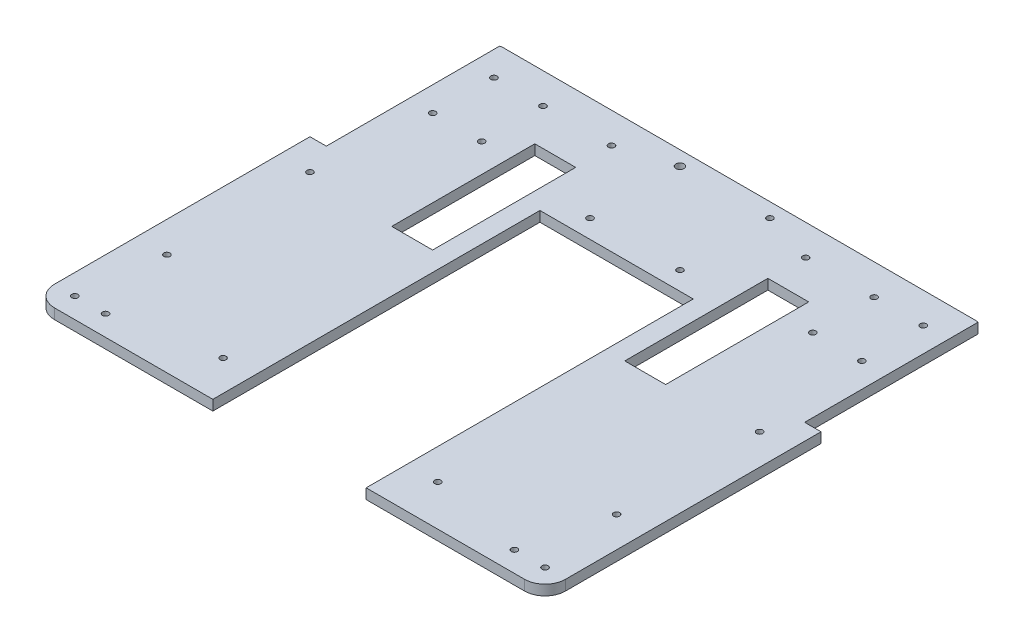
from build123d import *

# Parameters (mm, degrees)
EXTRUDE_1_DEPTH      = 5
SKETCH_5_W           = 75
SKETCH_5_H           = 160
CUT_EXTRUDE_4_DEPTH  = 5
CUT_EXTRUDE_5_REACH  = 335.054
SKETCH_6_R           = 1.5
CUT_EXTRUDE_8_REACH  = 335.054
SKETCH_8_R           = 1.5
CUT_EXTRUDE_9_REACH  = 335.054
SKETCH_9_R           = 1.5
CUT_EXTRUDE_10_REACH = 335.054
SKETCH_10_W          = 8
SKETCH_10_H          = 85
SKETCH_11_R          = 1.5
CUT_EXTRUDE_11_DEPTH = 10
SKETCH_12_R          = 1.5
CUT_EXTRUDE_12_DEPTH = 10
SKETCH_13_W          = 20
SKETCH_13_H          = 70
CUT_EXTRUDE_13_DEPTH = 10
SKETCH_14_R          = 2
SKETCH_14_R_2        = 1.5
CUT_EXTRUDE_14_DEPTH = 10


with BuildPart() as part:
    # 草图1 → 凸台-拉伸1 (new body)
    with BuildSketch(Plane(origin=(0, 0, 0), x_dir=(1, 0, 0), z_dir=(0, 1, 0))):
        with BuildLine():
            Line((10, 0), (240, 0))
            ThreePointArc((240, 0), (247.071067812, -2.928932188), (250, -10))
            Line((250, -10), (250, -210))
            ThreePointArc((250, -210), (247.071067812, -217.071067812), (240, -220))
            Line((240, -220), (10, -220))
            ThreePointArc((10, -220), (2.928932188, -217.071067812), (0, -210))
            Line((0, -210), (0, -10))
            ThreePointArc((0, -10), (2.928932188, -2.928932188), (10, 0))
        make_face()
    extrude(amount=EXTRUDE_1_DEPTH)

    # 草图5 → 切除-拉伸4 (cut)
    with BuildSketch(Plane.XZ):
        with Locations((125, 140)):
            Rectangle(SKETCH_5_W, SKETCH_5_H)
    extrude(amount=-CUT_EXTRUDE_4_DEPTH, mode=Mode.SUBTRACT)

    # 草图6 → 切除-拉伸5 (cut, up to next)
    with BuildSketch(Plane.XZ, mode=Mode.PRIVATE) as cut_extrude_5_sk1:
        with Locations((72.5, 200)):
            Circle(SKETCH_6_R)
    cut_extrude_5_tool1 = extrude(cut_extrude_5_sk1.sketch, amount=-CUT_EXTRUDE_5_REACH, mode=Mode.PRIVATE) & part.part
    # 草图6 → 切除-拉伸5 (cut, up to next)
    with BuildSketch(Plane.XZ, mode=Mode.PRIVATE) as cut_extrude_5_sk2:
        with Locations((177.5, 200)):
            Circle(SKETCH_6_R)
    cut_extrude_5_tool2 = extrude(cut_extrude_5_sk2.sketch, amount=-CUT_EXTRUDE_5_REACH, mode=Mode.PRIVATE) & part.part
    add(cut_extrude_5_tool1.solids().sort_by_distance((72.5, 0, 200))[0], mode=Mode.SUBTRACT)
    add(cut_extrude_5_tool2.solids().sort_by_distance((177.5, 0, 200))[0], mode=Mode.SUBTRACT)

    # 草图8 → 切除-拉伸8 (cut, up to next)
    with BuildSketch(Plane.XZ, mode=Mode.PRIVATE) as cut_extrude_8_sk1:
        with Locations((235, 170)):
            Circle(SKETCH_8_R)
    cut_extrude_8_tool1 = extrude(cut_extrude_8_sk1.sketch, amount=-CUT_EXTRUDE_8_REACH, mode=Mode.PRIVATE) & part.part
    # 草图8 → 切除-拉伸8 (cut, up to next)
    with BuildSketch(Plane.XZ, mode=Mode.PRIVATE) as cut_extrude_8_sk2:
        with Locations((235, 100)):
            Circle(SKETCH_8_R)
    cut_extrude_8_tool2 = extrude(cut_extrude_8_sk2.sketch, amount=-CUT_EXTRUDE_8_REACH, mode=Mode.PRIVATE) & part.part
    # 草图8 → 切除-拉伸8 (cut, up to next)
    with BuildSketch(Plane.XZ, mode=Mode.PRIVATE) as cut_extrude_8_sk3:
        with Locations((15, 100)):
            Circle(SKETCH_8_R)
    cut_extrude_8_tool3 = extrude(cut_extrude_8_sk3.sketch, amount=-CUT_EXTRUDE_8_REACH, mode=Mode.PRIVATE) & part.part
    # 草图8 → 切除-拉伸8 (cut, up to next)
    with BuildSketch(Plane.XZ, mode=Mode.PRIVATE) as cut_extrude_8_sk4:
        with Locations((15, 170)):
            Circle(SKETCH_8_R)
    cut_extrude_8_tool4 = extrude(cut_extrude_8_sk4.sketch, amount=-CUT_EXTRUDE_8_REACH, mode=Mode.PRIVATE) & part.part
    add(cut_extrude_8_tool1.solids().sort_by_distance((235, 0, 170))[0], mode=Mode.SUBTRACT)
    add(cut_extrude_8_tool2.solids().sort_by_distance((235, 0, 100))[0], mode=Mode.SUBTRACT)
    add(cut_extrude_8_tool3.solids().sort_by_distance((15, 0, 100))[0], mode=Mode.SUBTRACT)
    add(cut_extrude_8_tool4.solids().sort_by_distance((15, 0, 170))[0], mode=Mode.SUBTRACT)

    # 草图9 → 切除-拉伸9 (cut, up to next)
    with BuildSketch(Plane.XZ, mode=Mode.PRIVATE) as cut_extrude_9_sk1:
        with Locations((77.5, 15)):
            Circle(SKETCH_9_R)
    cut_extrude_9_tool1 = extrude(cut_extrude_9_sk1.sketch, amount=-CUT_EXTRUDE_9_REACH, mode=Mode.PRIVATE) & part.part
    # 草图9 → 切除-拉伸9 (cut, up to next)
    with BuildSketch(Plane.XZ, mode=Mode.PRIVATE) as cut_extrude_9_sk2:
        with Locations((10, 210)):
            Circle(SKETCH_9_R)
    cut_extrude_9_tool2 = extrude(cut_extrude_9_sk2.sketch, amount=-CUT_EXTRUDE_9_REACH, mode=Mode.PRIVATE) & part.part
    # 草图9 → 切除-拉伸9 (cut, up to next)
    with BuildSketch(Plane.XZ, mode=Mode.PRIVATE) as cut_extrude_9_sk3:
        with Locations((240, 210)):
            Circle(SKETCH_9_R)
    cut_extrude_9_tool3 = extrude(cut_extrude_9_sk3.sketch, amount=-CUT_EXTRUDE_9_REACH, mode=Mode.PRIVATE) & part.part
    # 草图9 → 切除-拉伸9 (cut, up to next)
    with BuildSketch(Plane.XZ, mode=Mode.PRIVATE) as cut_extrude_9_sk4:
        with Locations((172.5, 15)):
            Circle(SKETCH_9_R)
    cut_extrude_9_tool4 = extrude(cut_extrude_9_sk4.sketch, amount=-CUT_EXTRUDE_9_REACH, mode=Mode.PRIVATE) & part.part
    add(cut_extrude_9_tool1.solids().sort_by_distance((77.5, 0, 15))[0], mode=Mode.SUBTRACT)
    add(cut_extrude_9_tool2.solids().sort_by_distance((10, 0, 210))[0], mode=Mode.SUBTRACT)
    add(cut_extrude_9_tool3.solids().sort_by_distance((240, 0, 210))[0], mode=Mode.SUBTRACT)
    add(cut_extrude_9_tool4.solids().sort_by_distance((172.5, 0, 15))[0], mode=Mode.SUBTRACT)

    # 草图10 → 切除-拉伸10 (cut, up to next)
    with BuildSketch(Plane.XZ, mode=Mode.PRIVATE) as cut_extrude_10_sk1:
        with Locations((4, 42.5)):
            Rectangle(SKETCH_10_W, SKETCH_10_H)
    cut_extrude_10_tool1 = extrude(cut_extrude_10_sk1.sketch, amount=-CUT_EXTRUDE_10_REACH, mode=Mode.PRIVATE) & part.part
    # 草图10 → 切除-拉伸10 (cut, up to next)
    with BuildSketch(Plane.XZ, mode=Mode.PRIVATE) as cut_extrude_10_sk2:
        with Locations((246, 42.5)):
            Rectangle(SKETCH_10_W, SKETCH_10_H)
    cut_extrude_10_tool2 = extrude(cut_extrude_10_sk2.sketch, amount=-CUT_EXTRUDE_10_REACH, mode=Mode.PRIVATE) & part.part
    add(cut_extrude_10_tool1.solids().sort_by_distance((4, 0, 42.5))[0], mode=Mode.SUBTRACT)
    add(cut_extrude_10_tool2.solids().sort_by_distance((246, 0, 42.5))[0], mode=Mode.SUBTRACT)

    # 草图11 → 切除-拉伸11 (cut)
    with BuildSketch(Plane.XZ):
        with Locations((25, 210)):
            Circle(SKETCH_11_R)
        with Locations((225, 210)):
            Circle(SKETCH_11_R)
    extrude(amount=-CUT_EXTRUDE_11_DEPTH, mode=Mode.SUBTRACT)

    # 草图12 → 切除-拉伸12 (cut)
    with BuildSketch(Plane.XZ):
        with Locations((230, 15)):
            Circle(SKETCH_12_R)
        with Locations((206, 15)):
            Circle(SKETCH_12_R)
        with Locations((230, 45)):
            Circle(SKETCH_12_R)
        with Locations((206, 45)):
            Circle(SKETCH_12_R)
        with Locations((44, 45)):
            Circle(SKETCH_12_R)
        with Locations((20, 45)):
            Circle(SKETCH_12_R)
        with Locations((44, 15)):
            Circle(SKETCH_12_R)
        with Locations((20, 15)):
            Circle(SKETCH_12_R)
    extrude(amount=-CUT_EXTRUDE_12_DEPTH, mode=Mode.SUBTRACT)

    # 草图13 → 切除-拉伸13 (cut)
    with BuildSketch(Plane.XZ):
        with Locations((68, 68)):
            Rectangle(SKETCH_13_W, SKETCH_13_H)
        with Locations((182, 68)):
            Rectangle(SKETCH_13_W, SKETCH_13_H)
    extrude(amount=-CUT_EXTRUDE_13_DEPTH, mode=Mode.SUBTRACT)

    # 草图14 → 切除-拉伸14 (cut)
    with BuildSketch(Plane.XZ):
        with Locations((103, 7)):
            Circle(SKETCH_14_R)
        with Locations((103, 51)):
            Circle(SKETCH_14_R_2)
        with Locations((147, 51)):
            Circle(SKETCH_14_R_2)
        with Locations((147, 7)):
            Circle(SKETCH_14_R_2)
    extrude(amount=-CUT_EXTRUDE_14_DEPTH, mode=Mode.SUBTRACT)


solid = part.part
